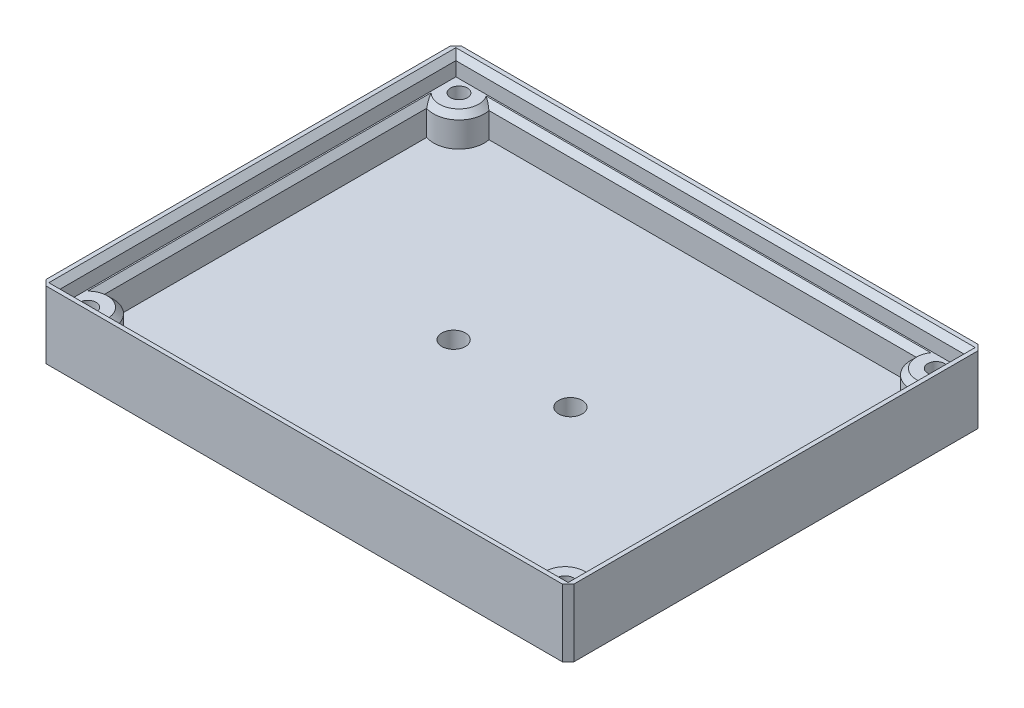
from build123d import *

# Parameters (mm, degrees)
SKETCH1_W           = 94
SKETCH1_H           = 74
BOSS_EXTRUDE1_DEPTH = 12
SKETCH2_W           = 90.5
SKETCH2_H           = 70.5
CUT_EXTRUDE1_DEPTH  = 3.5
SKETCH3_R           = 1.5
CUT_EXTRUDE2_DEPTH  = 6
SHELL1_START        = 3
SHELL1_DEPTH        = 5.5
CHAMFER1_SIZE       = 1
CHAMFER2_SIZE       = 1
CHAMFER3_SIZE       = 1
SKETCH4_R           = 2.1
CUT_EXTRUDE3_DEPTH  = 61.489668539


# Read off the part's stored shape, not the designer's step: Shell1
with BuildPart() as part:
    # Sketch1 → Boss-Extrude1 (new body)
    with BuildSketch(Plane(origin=(0, 0, 0), x_dir=(1, 0, 0), z_dir=(0, 1, 0))):
        Rectangle(SKETCH1_W, SKETCH1_H)
    extrude(amount=BOSS_EXTRUDE1_DEPTH)

    # Sketch2 → Cut-Extrude1 (cut)
    with BuildSketch(Plane(origin=(0, 12, 0), x_dir=(1, 0, 0), z_dir=(0, 1, 0))):
        Rectangle(SKETCH2_W, SKETCH2_H)
    extrude(amount=-CUT_EXTRUDE1_DEPTH, mode=Mode.SUBTRACT)

    # Sketch3 → Cut-Extrude2 (cut)
    with BuildSketch(Plane(origin=(0, 8.5, 0), x_dir=(1, 0, 0), z_dir=(0, 1, 0))):
        with Locations(Location((-42.5, 33.055555556, 0), (0, 0, 270))):
            Circle(SKETCH3_R)
        with Locations(Location((42.5, 33.055555556, 0), (0, 0, 270))):
            Circle(SKETCH3_R)
        with Locations(Location((42.5, -33.055555556, 0), (0, 0, 270))):
            Circle(SKETCH3_R)
        with Locations(Location((-42.5, -33.055555556, 0), (0, 0, 270))):
            Circle(SKETCH3_R)
    extrude(amount=-CUT_EXTRUDE2_DEPTH, mode=Mode.SUBTRACT)

    # Shell1 outline → Shell1 (cut)
    with BuildSketch(Plane(origin=(0, 0, 0), x_dir=(1, 0, 0), z_dir=(0, 1, 0)).offset(SHELL1_START)):
        with BuildLine():
            Line((-38.100224473, -34), (38.100224473, -34))
            ThreePointArc((38.100224473, -34), (39.528697665, -29.67600493), (44, -28.812914868))
            Line((44, -28.812914868), (44, 28.812914868))
            ThreePointArc((44, 28.812914868), (39.528697665, 29.67600493), (38.100224473, 34))
            Line((38.100224473, 34), (-38.100224473, 34))
            ThreePointArc((-38.100224473, 34), (-39.528697665, 29.67600493), (-44, 28.812914868))
            Line((-44, 28.812914868), (-44, -28.812914868))
            ThreePointArc((-44, -28.812914868), (-39.528697665, -29.67600493), (-38.100224473, -34))
        make_face()
    extrude(amount=SHELL1_DEPTH, mode=Mode.SUBTRACT)

    # Chamfer1
    chamfer1_edges = [part.edges().sort_by_distance(p)[0] for p in [
        (45.25, 12, 0),
        (0, 12, -35.25),
        (-45.25, 12, 0),
        (0, 12, 35.25),
    ]]
    chamfer(chamfer1_edges, length=CHAMFER1_SIZE)

    # Chamfer2
    chamfer2_edges = [part.edges().sort_by_distance(p)[0] for p in [
        (0, 8.5, 34),
        (44, 8.5, 0),
        (0, 8.5, -34),
        (-44, 8.5, 0),
        (-39.528697665, 8.5, -29.67600493),
        (39.528697665, 8.5, -29.67600493),
        (39.528697665, 8.5, 29.67600493),
        (-39.528697665, 8.5, 29.67600493),
    ]]
    chamfer(chamfer2_edges, length=CHAMFER2_SIZE)

    # Chamfer3
    chamfer3_edges = [part.edges().sort_by_distance(p)[0] for p in [
        (-47, 6, 37),
        (-47, 6, -37),
        (47, 6, -37),
        (47, 6, 37),
    ]]
    chamfer(chamfer3_edges, length=CHAMFER3_SIZE)

    # Sketch4 → Cut-Extrude3 (cut, through all)
    with BuildSketch(Plane(origin=(0, 3, 0), x_dir=(1, 0, 0), z_dir=(0, 1, 0))):
        with Locations(Location((-10.4, 0, 0), (0, 0, 270))):
            Circle(SKETCH4_R)
        with Locations(Location((10.4, 0, 0), (0, 0, 270))):
            Circle(SKETCH4_R)
    extrude(amount=-CUT_EXTRUDE3_DEPTH, mode=Mode.SUBTRACT)


solid = part.part
